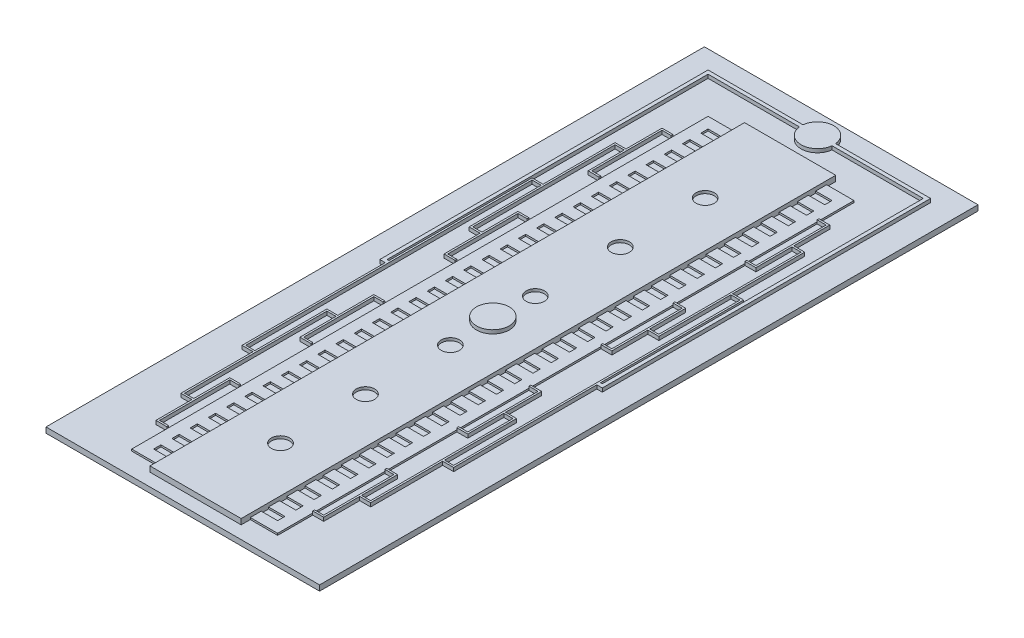
from build123d import *

# Parameters (mm, degrees)
SKETCH1_W           = 15
SKETCH1_H           = 39
BOSS_EXTRUDE1_DEPTH = 0.3
SKETCH2_W           = 5
SKETCH2_H           = 32.6
BOSS_EXTRUDE2_DEPTH = 0.3
SKETCH3_W           = 1.5
SKETCH3_H           = 31.6
BOSS_EXTRUDE3_DEPTH = 0.1
SKETCH4_W           = 0.9
SKETCH4_H           = 0.4
CUT_EXTRUDE1_DEPTH  = 0.1
BOSS_EXTRUDE4_DEPTH = 0.2
SKETCH6_R           = 0.9
BOSS_EXTRUDE5_DEPTH = 0.2
SKETCH7_R           = 0.5
CUT_EXTRUDE2_DEPTH  = 0.15
SKETCH9_W           = 15
SKETCH9_H           = 0.3
CUT_EXTRUDE5_DEPTH  = 2.5
SKETCH10_W          = 15
SKETCH10_H          = 0.3
CUT_EXTRUDE6_DEPTH  = 0.4


# Read off the part's stored shape, not the designer's step: Boss-Extrude4
with BuildPart() as part:
    # Sketch1 → Boss-Extrude1 (new body)
    with BuildSketch(Plane(origin=(0, 0, 0), x_dir=(1, 0, 0), z_dir=(0, 1, 0))):
        Rectangle(SKETCH1_W, SKETCH1_H)
    extrude(amount=BOSS_EXTRUDE1_DEPTH)

    # Sketch2 → Boss-Extrude2 (add)
    with BuildSketch(Plane(origin=(0, 0.3, 0), x_dir=(1, 0, 0), z_dir=(0, 1, 0))):
        Rectangle(SKETCH2_W, SKETCH2_H)
    extrude(amount=BOSS_EXTRUDE2_DEPTH)

    # Sketch3 → Boss-Extrude3 (add)
    with BuildSketch(Plane(origin=(0, 0.3, 0), x_dir=(1, 0, 0), z_dir=(0, 1, 0))):
        with Locations((3.25, 0)):
            Rectangle(SKETCH3_W, SKETCH3_H)
        with Locations((-3.25, 0)):
            Rectangle(SKETCH3_W, SKETCH3_H)
    extrude(amount=BOSS_EXTRUDE3_DEPTH)

    # Sketch4 → Cut-Extrude1 (cut)
    with BuildSketch(Plane(origin=(0, 0.4, 0), x_dir=(1, 0, 0), z_dir=(0, 1, 0))):
        with Locations((2.95, 15)):
            Rectangle(SKETCH4_W, SKETCH4_H)
        with Locations((-2.95, 15)):
            Rectangle(SKETCH4_W, SKETCH4_H)
        with Locations((-2.95, 14)):
            Rectangle(SKETCH4_W, SKETCH4_H)
        with Locations((-2.95, 13)):
            Rectangle(SKETCH4_W, SKETCH4_H)
        with Locations((-2.95, 12)):
            Rectangle(SKETCH4_W, SKETCH4_H)
        with Locations((-2.95, 11)):
            Rectangle(SKETCH4_W, SKETCH4_H)
        with Locations((-2.95, 10)):
            Rectangle(SKETCH4_W, SKETCH4_H)
        with Locations((-2.95, 9)):
            Rectangle(SKETCH4_W, SKETCH4_H)
        with Locations((-2.95, 8)):
            Rectangle(SKETCH4_W, SKETCH4_H)
        with Locations((-2.95, 7)):
            Rectangle(SKETCH4_W, SKETCH4_H)
        with Locations((-2.95, 6)):
            Rectangle(SKETCH4_W, SKETCH4_H)
        with Locations((-2.95, 5)):
            Rectangle(SKETCH4_W, SKETCH4_H)
        with Locations((-2.95, 4)):
            Rectangle(SKETCH4_W, SKETCH4_H)
        with Locations((-2.95, 3)):
            Rectangle(SKETCH4_W, SKETCH4_H)
        with Locations((-2.95, 2)):
            Rectangle(SKETCH4_W, SKETCH4_H)
        with Locations((-2.95, 1)):
            Rectangle(SKETCH4_W, SKETCH4_H)
        with Locations((-2.95, 0)):
            Rectangle(SKETCH4_W, SKETCH4_H)
        with Locations((-2.95, -1)):
            Rectangle(SKETCH4_W, SKETCH4_H)
        with Locations((-2.95, -2)):
            Rectangle(SKETCH4_W, SKETCH4_H)
        with Locations((-2.95, -3)):
            Rectangle(SKETCH4_W, SKETCH4_H)
        with Locations((-2.95, -4)):
            Rectangle(SKETCH4_W, SKETCH4_H)
        with Locations((-2.95, -5)):
            Rectangle(SKETCH4_W, SKETCH4_H)
        with Locations((-2.95, -6)):
            Rectangle(SKETCH4_W, SKETCH4_H)
        with Locations((-2.95, -7)):
            Rectangle(SKETCH4_W, SKETCH4_H)
        with Locations((-2.95, -8)):
            Rectangle(SKETCH4_W, SKETCH4_H)
        with Locations((-2.95, -9)):
            Rectangle(SKETCH4_W, SKETCH4_H)
        with Locations((-2.95, -10)):
            Rectangle(SKETCH4_W, SKETCH4_H)
        with Locations((-2.95, -11)):
            Rectangle(SKETCH4_W, SKETCH4_H)
        with Locations((-2.95, -12)):
            Rectangle(SKETCH4_W, SKETCH4_H)
        with Locations((-2.95, -13)):
            Rectangle(SKETCH4_W, SKETCH4_H)
        with Locations((-2.95, -14)):
            Rectangle(SKETCH4_W, SKETCH4_H)
        with Locations((-2.95, -15)):
            Rectangle(SKETCH4_W, SKETCH4_H)
        with Locations((2.95, 14)):
            Rectangle(SKETCH4_W, SKETCH4_H)
        with Locations((2.95, 13)):
            Rectangle(SKETCH4_W, SKETCH4_H)
        with Locations((2.95, 12)):
            Rectangle(SKETCH4_W, SKETCH4_H)
        with Locations((2.95, 11)):
            Rectangle(SKETCH4_W, SKETCH4_H)
        with Locations((2.95, 10)):
            Rectangle(SKETCH4_W, SKETCH4_H)
        with Locations((2.95, 9)):
            Rectangle(SKETCH4_W, SKETCH4_H)
        with Locations((2.95, 8)):
            Rectangle(SKETCH4_W, SKETCH4_H)
        with Locations((2.95, 7)):
            Rectangle(SKETCH4_W, SKETCH4_H)
        with Locations((2.95, 6)):
            Rectangle(SKETCH4_W, SKETCH4_H)
        with Locations((2.95, 5)):
            Rectangle(SKETCH4_W, SKETCH4_H)
        with Locations((2.95, 4)):
            Rectangle(SKETCH4_W, SKETCH4_H)
        with Locations((2.95, 3)):
            Rectangle(SKETCH4_W, SKETCH4_H)
        with Locations((2.95, 2)):
            Rectangle(SKETCH4_W, SKETCH4_H)
        with Locations((2.95, 1)):
            Rectangle(SKETCH4_W, SKETCH4_H)
        with Locations((2.95, 0)):
            Rectangle(SKETCH4_W, SKETCH4_H)
        with Locations((2.95, -1)):
            Rectangle(SKETCH4_W, SKETCH4_H)
        with Locations((2.95, -2)):
            Rectangle(SKETCH4_W, SKETCH4_H)
        with Locations((2.95, -3)):
            Rectangle(SKETCH4_W, SKETCH4_H)
        with Locations((2.95, -4)):
            Rectangle(SKETCH4_W, SKETCH4_H)
        with Locations((2.95, -5)):
            Rectangle(SKETCH4_W, SKETCH4_H)
        with Locations((2.95, -6)):
            Rectangle(SKETCH4_W, SKETCH4_H)
        with Locations((2.95, -7)):
            Rectangle(SKETCH4_W, SKETCH4_H)
        with Locations((2.95, -8)):
            Rectangle(SKETCH4_W, SKETCH4_H)
        with Locations((2.95, -9)):
            Rectangle(SKETCH4_W, SKETCH4_H)
        with Locations((2.95, -10)):
            Rectangle(SKETCH4_W, SKETCH4_H)
        with Locations((2.95, -11)):
            Rectangle(SKETCH4_W, SKETCH4_H)
        with Locations((2.95, -12)):
            Rectangle(SKETCH4_W, SKETCH4_H)
        with Locations((2.95, -13)):
            Rectangle(SKETCH4_W, SKETCH4_H)
        with Locations((2.95, -14)):
            Rectangle(SKETCH4_W, SKETCH4_H)
        with Locations((2.95, -15)):
            Rectangle(SKETCH4_W, SKETCH4_H)
    extrude(amount=-CUT_EXTRUDE1_DEPTH, mode=Mode.SUBTRACT)

    # Boss-Extrude4 outline → Boss-Extrude4 (add)
    with BuildSketch(Plane(origin=(0, 0.3, 0), x_dir=(1, 0, 0), z_dir=(0, 1, 0))):
        with BuildLine():
            Line((-5.9, 17.7), (-0.894427191, 17.7))
            ThreePointArc((-0.894427191, 17.7), (0, 16.9), (0.894427191, 17.7))
            Line((0.894427191, 17.7), (5.9, 17.7))
            Line((5.9, 17.7), (5.9, 0.1))
            Line((5.9, 0.1), (5.8, 0.1))
            Line((5.8, 0.1), (5.8, 7.95))
            Line((5.8, 7.95), (5.2, 7.95))
            Line((5.2, 7.95), (5.2, 11.9))
            Line((5.2, 11.9), (4.6, 11.9))
            Line((4.6, 11.9), (4.6, 13.875))
            Line((4.6, 13.875), (4, 13.875))
            Line((4, 13.875), (4, 13.775))
            Line((4, 13.775), (4.5, 13.775))
            Line((4.5, 13.775), (4.5, 9.925))
            Line((4.5, 9.925), (4, 9.925))
            Line((4, 9.925), (4, 9.825))
            Line((4, 9.825), (4.6, 9.825))
            Line((4.6, 9.825), (4.6, 11.8))
            Line((4.6, 11.8), (5.1, 11.8))
            Line((5.1, 11.8), (5.1, 4))
            Line((5.1, 4), (4.6, 4))
            Line((4.6, 4), (4.6, 5.975))
            Line((4.6, 5.975), (4, 5.975))
            Line((4, 5.975), (4, 5.875))
            Line((4, 5.875), (4.5, 5.875))
            Line((4.5, 5.875), (4.5, 2.025))
            Line((4.5, 2.025), (4, 2.025))
            Line((4, 2.025), (4, 1.925))
            Line((4, 1.925), (4.6, 1.925))
            Line((4.6, 1.925), (4.6, 3.9))
            Line((4.6, 3.9), (5.2, 3.9))
            Line((5.2, 3.9), (5.2, 7.85))
            Line((5.2, 7.85), (5.7, 7.85))
            Line((5.7, 7.85), (5.7, -7.85))
            Line((5.7, -7.85), (5.2, -7.85))
            Line((5.2, -7.85), (5.2, -3.9))
            Line((5.2, -3.9), (4.6, -3.9))
            Line((4.6, -3.9), (4.6, -1.925))
            Line((4.6, -1.925), (4, -1.925))
            Line((4, -1.925), (4, -2.025))
            Line((4, -2.025), (4.5, -2.025))
            Line((4.5, -2.025), (4.5, -5.875))
            Line((4.5, -5.875), (4, -5.875))
            Line((4, -5.875), (4, -5.975))
            Line((4, -5.975), (4.6, -5.975))
            Line((4.6, -5.975), (4.6, -4))
            Line((4.6, -4), (5.1, -4))
            Line((5.1, -4), (5.1, -11.8))
            Line((5.1, -11.8), (4.6, -11.8))
            Line((4.6, -11.8), (4.6, -9.825))
            Line((4.6, -9.825), (4, -9.825))
            Line((4, -9.825), (4, -9.925))
            Line((4, -9.925), (4.5, -9.925))
            Line((4.5, -9.925), (4.5, -13.775))
            Line((4.5, -13.775), (4, -13.775))
            Line((4, -13.775), (4, -13.875))
            Line((4, -13.875), (4.6, -13.875))
            Line((4.6, -13.875), (4.6, -11.9))
            Line((4.6, -11.9), (5.2, -11.9))
            Line((5.2, -11.9), (5.2, -7.95))
            Line((5.2, -7.95), (5.8, -7.95))
            Line((5.8, -7.95), (5.8, -0.1))
            Line((5.8, -0.1), (6.1, -0.1))
            Line((6.1, -0.1), (6.1, 17.9))
            Line((6.1, 17.9), (0.894427191, 17.9))
            ThreePointArc((0.894427191, 17.9), (0, 18.7), (-0.894427191, 17.9))
            Line((-0.894427191, 17.9), (-6.1, 17.9))
            Line((-6.1, 17.9), (-6.1, -0.1))
            Line((-6.1, -0.1), (-5.8, -0.1))
            Line((-5.8, -0.1), (-5.8, -7.95))
            Line((-5.8, -7.95), (-5.2, -7.95))
            Line((-5.2, -7.95), (-5.2, -11.9))
            Line((-5.2, -11.9), (-4.6, -11.9))
            Line((-4.6, -11.9), (-4.6, -13.875))
            Line((-4.6, -13.875), (-4, -13.875))
            Line((-4, -13.875), (-4, -13.775))
            Line((-4, -13.775), (-4.5, -13.775))
            Line((-4.5, -13.775), (-4.5, -9.925))
            Line((-4.5, -9.925), (-4, -9.925))
            Line((-4, -9.925), (-4, -9.825))
            Line((-4, -9.825), (-4.6, -9.825))
            Line((-4.6, -9.825), (-4.6, -11.8))
            Line((-4.6, -11.8), (-5.1, -11.8))
            Line((-5.1, -11.8), (-5.1, -4))
            Line((-5.1, -4), (-4.6, -4))
            Line((-4.6, -4), (-4.6, -5.975))
            Line((-4.6, -5.975), (-4, -5.975))
            Line((-4, -5.975), (-4, -5.875))
            Line((-4, -5.875), (-4.5, -5.875))
            Line((-4.5, -5.875), (-4.5, -2.025))
            Line((-4.5, -2.025), (-4, -2.025))
            Line((-4, -2.025), (-4, -1.925))
            Line((-4, -1.925), (-4.6, -1.925))
            Line((-4.6, -1.925), (-4.6, -3.9))
            Line((-4.6, -3.9), (-5.2, -3.9))
            Line((-5.2, -3.9), (-5.2, -7.85))
            Line((-5.2, -7.85), (-5.7, -7.85))
            Line((-5.7, -7.85), (-5.7, 7.85))
            Line((-5.7, 7.85), (-5.2, 7.85))
            Line((-5.2, 7.85), (-5.2, 3.9))
            Line((-5.2, 3.9), (-4.6, 3.9))
            Line((-4.6, 3.9), (-4.6, 1.925))
            Line((-4.6, 1.925), (-4, 1.925))
            Line((-4, 1.925), (-4, 2.025))
            Line((-4, 2.025), (-4.5, 2.025))
            Line((-4.5, 2.025), (-4.5, 5.875))
            Line((-4.5, 5.875), (-4, 5.875))
            Line((-4, 5.875), (-4, 5.975))
            Line((-4, 5.975), (-4.6, 5.975))
            Line((-4.6, 5.975), (-4.6, 4))
            Line((-4.6, 4), (-5.1, 4))
            Line((-5.1, 4), (-5.1, 11.8))
            Line((-5.1, 11.8), (-4.6, 11.8))
            Line((-4.6, 11.8), (-4.6, 9.825))
            Line((-4.6, 9.825), (-4, 9.825))
            Line((-4, 9.825), (-4, 9.925))
            Line((-4, 9.925), (-4.5, 9.925))
            Line((-4.5, 9.925), (-4.5, 13.775))
            Line((-4.5, 13.775), (-4, 13.775))
            Line((-4, 13.775), (-4, 13.875))
            Line((-4, 13.875), (-4.6, 13.875))
            Line((-4.6, 13.875), (-4.6, 11.9))
            Line((-4.6, 11.9), (-5.2, 11.9))
            Line((-5.2, 11.9), (-5.2, 7.95))
            Line((-5.2, 7.95), (-5.8, 7.95))
            Line((-5.8, 7.95), (-5.8, 0.1))
            Line((-5.8, 0.1), (-5.9, 0.1))
            Line((-5.9, 0.1), (-5.9, 17.7))
        make_face()
    extrude(amount=BOSS_EXTRUDE4_DEPTH)

    # Sketch6 → Boss-Extrude5 (add)
    with BuildSketch(Plane(origin=(0, 0.6, 0), x_dir=(1, 0, 0), z_dir=(0, 1, 0))):
        with Locations(Location((0, 0, 0), (0, 0, 270))):
            Circle(SKETCH6_R)
    extrude(amount=BOSS_EXTRUDE5_DEPTH)

    # Sketch7 → Cut-Extrude2 (cut)
    with BuildSketch(Plane(origin=(0, 0.6, 0), x_dir=(1, 0, 0), z_dir=(0, 1, 0))):
        with Locations(Location((0, 11.64285732, 0), (0, 0, 270))):
            Circle(SKETCH7_R)
        with Locations(Location((0, 6.98571446, 0), (0, 0, 270))):
            Circle(SKETCH7_R)
        with Locations(Location((0, 2.3285716, 0), (0, 0, 270))):
            Circle(SKETCH7_R)
        with Locations(Location((0, -2.32857126, 0), (0, 0, 270))):
            Circle(SKETCH7_R)
        with Locations(Location((0, -6.98571412, 0), (0, 0, 270))):
            Circle(SKETCH7_R)
        with Locations(Location((0, -11.64285698, 0), (0, 0, 270))):
            Circle(SKETCH7_R)
    extrude(amount=-CUT_EXTRUDE2_DEPTH, mode=Mode.SUBTRACT)

    # Sketch9 → Cut-Extrude5 (cut)
    with BuildSketch(Plane.XY.offset(19.5)):
        with Locations((0, 0.15)):
            Rectangle(SKETCH9_W, SKETCH9_H)
    extrude(amount=-CUT_EXTRUDE5_DEPTH, mode=Mode.SUBTRACT)

    # Sketch10 → Cut-Extrude6 (cut)
    with BuildSketch(Plane(origin=(0, 0, -19.5), x_dir=(-1, 0, 0), z_dir=(0, 0, -1))):
        with Locations((0, 0.15)):
            Rectangle(SKETCH10_W, SKETCH10_H)
    extrude(amount=-CUT_EXTRUDE6_DEPTH, mode=Mode.SUBTRACT)


solid = part.part
